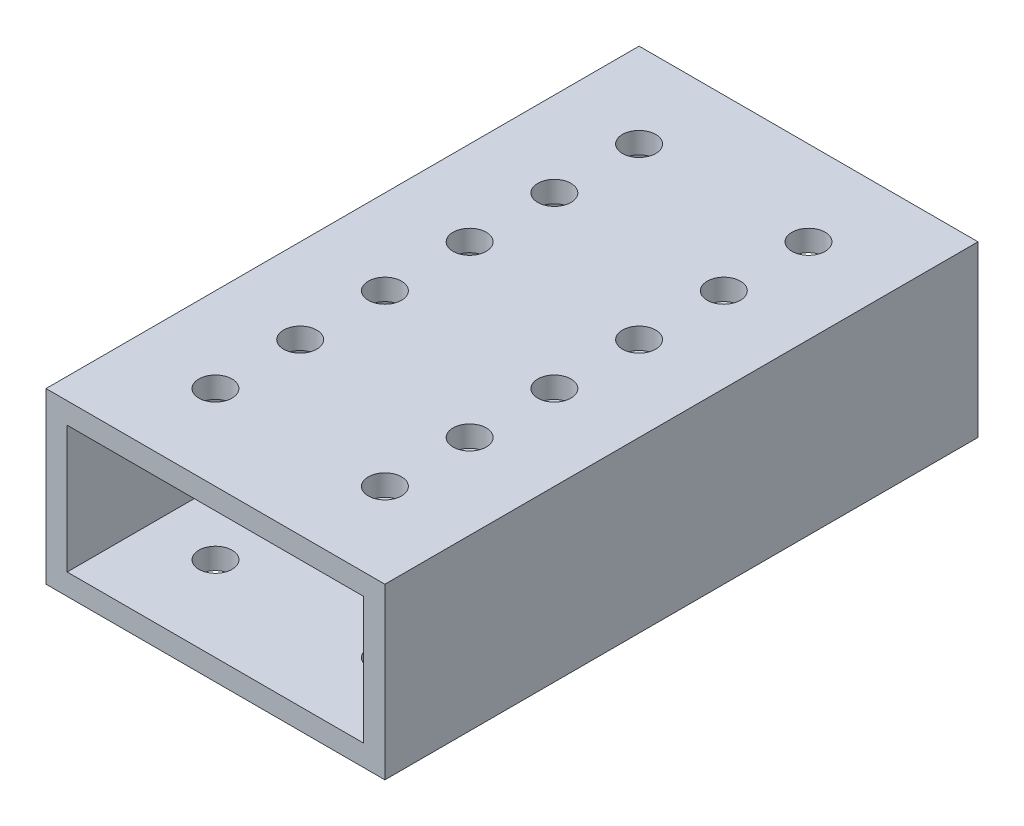
from build123d import *

# Parameters (mm, degrees)
SKETCH1_W           = 50.8
SKETCH1_H           = 25.4
BOSS_EXTRUDE1_DEPTH = 44.45
SHELL1_T            = -3.175
SKETCH2_R           = 2.4892
CUT_EXTRUDE1_DEPTH  = 63.5


with BuildPart() as part:
    # Sketch1 → Boss-Extrude1 (new, symmetric)
    with BuildSketch(Plane.XY):
        Rectangle(SKETCH1_W, SKETCH1_H)
    extrude(amount=BOSS_EXTRUDE1_DEPTH, both=True)

    # Shell1
    shell1_openings = [part.faces().sort_by_distance(p)[0] for p in [
        (0, 0, -44.45),
        (0, 0, 44.45),
    ]]
    offset(amount=SHELL1_T, openings=shell1_openings, kind=Kind.INTERSECTION)

    # Sketch2 → Cut-Extrude1 (cut, symmetric)
    with BuildSketch(Plane(origin=(0, 0, 0), x_dir=(1, 0, 0), z_dir=(0, 1, 0))):
        with Locations((-12.7, 31.75)):
            Circle(SKETCH2_R)
        with Locations((12.7, 31.75)):
            Circle(SKETCH2_R)
        with Locations((12.7, 19.05)):
            Circle(SKETCH2_R)
        with Locations((12.7, 6.35)):
            Circle(SKETCH2_R)
        with Locations((12.7, -6.35)):
            Circle(SKETCH2_R)
        with Locations((12.7, -19.05)):
            Circle(SKETCH2_R)
        with Locations((12.7, -31.75)):
            Circle(SKETCH2_R)
        with Locations((-12.7, 19.05)):
            Circle(SKETCH2_R)
        with Locations((-12.7, 6.35)):
            Circle(SKETCH2_R)
        with Locations((-12.7, -6.35)):
            Circle(SKETCH2_R)
        with Locations((-12.7, -19.05)):
            Circle(SKETCH2_R)
        with Locations((-12.7, -31.75)):
            Circle(SKETCH2_R)
    extrude(amount=CUT_EXTRUDE1_DEPTH, both=True, mode=Mode.SUBTRACT)


solid = part.part
